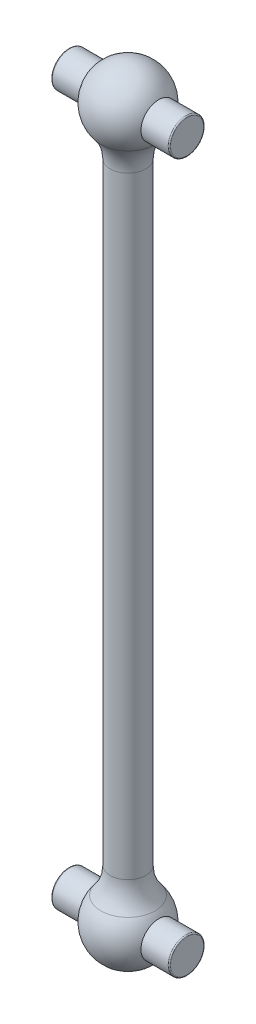
from build123d import *

# Parameters (mm, degrees)
SKETCH1_R           = 1.905
BOSS_EXTRUDE1_DEPTH = 38.1
SKETCH3_R           = 1.905
BOSS_EXTRUDE2_DEPTH = 6.35
FILLET1_R           = 0.127
MIRROR1_START       = -32.866055516
MIRROR1_2_OUTLINE_R = 1.905
MIRROR1_2_DEPTH     = 32.866055516


with BuildPart() as part:
    # Sketch1 → Boss-Extrude1 (new body)
    with BuildSketch(Plane(origin=(0, 0, 0), x_dir=(1, 0, 0), z_dir=(0, 1, 0))):
        with Locations(Location((0, 0, 0), (0, 0, 90))):
            Circle(SKETCH1_R)
    extrude(amount=BOSS_EXTRUDE1_DEPTH)

    # Sketch2 → Revolve2 (revolve)
    with BuildSketch(Plane.XY, mode=Mode.PRIVATE) as revolve2_sk:
        with BuildLine():
            Line((1.905, 32.866055516), (0, 32.866055516))
            Line((0, 32.866055516), (0, 41.91))
            ThreePointArc((0, 41.91), (3.453032669, 39.710175577), (2.918629328, 35.650979207))
            ThreePointArc((2.918629328, 35.650979207), (2.166286071, 34.347882461), (1.905, 32.866055516))
        make_face()
    revolve(revolve2_sk.sketch.rotate(Axis((0, 41.91, 0), (0, -1, 0)), 270), axis=Axis((0, 41.91, 0), (0, -1, 0)))

    # Sketch3 → Boss-Extrude2 (add, symmetric)
    with BuildSketch(Plane(origin=(0, 0, 0), x_dir=(0, 0, -1), z_dir=(1, 0, 0))):
        with Locations(Location((0, 38.1, 0), (0, 0, 180))):
            Circle(SKETCH3_R)
    extrude(amount=BOSS_EXTRUDE2_DEPTH, both=True)

    # Fillet1
    fillet1_edges = [part.edges().sort_by_distance(p)[0] for p in [
        (-6.35, 38.1, -1.905),
        (6.35, 38.1, -1.905),
    ]]
    fillet(fillet1_edges, radius=FILLET1_R)



with BuildPart() as body_2:
    # Mirror1: read off the stored shape, not the designer's step
    # Mirror1 outline → Mirror1 (revolve)
    with BuildSketch(Plane.XY):
        with BuildLine():
            Line((0, -32.866055516), (0, -41.91))
            ThreePointArc((0, -41.91), (3.453032669, -39.710175576), (2.918629327, -35.650979205))
            ThreePointArc((2.918629327, -35.650979205), (2.166286071, -34.347882461), (1.905, -32.866055516))
            Line((1.905, -32.866055516), (0, -32.866055516))
        make_face()
    revolve(axis=Axis((0, 0, 0), (0, 1, 0)))


with BuildPart() as part_1:
    add(part.part)

    add(body_2.part)  # Mirror1 2 merges body 2
    # Mirror1 2 outline → Mirror1 2 (add)
    with BuildSketch(Plane(origin=(0, 0, 0), x_dir=(1, 0, 0), z_dir=(0, 1, 0)).offset(MIRROR1_START)):
        Circle(MIRROR1_2_OUTLINE_R)
    extrude(amount=MIRROR1_2_DEPTH)

    # Mirror1 3 outline → Mirror1 3 (revolve)
    with BuildSketch(Plane(origin=(0, -38.1, 0), x_dir=(0, 1, 0), z_dir=(0, 0, -1))):
        with BuildLine():
            Line((1.778, 6.35), (0, 6.35))
            Line((0, 6.35), (0, 3.299556788))
            Line((0, 3.299556788), (1.905, 3.299556788))
            Line((1.905, 3.299556788), (1.905, 6.223))
            ThreePointArc((1.905, 6.223), (1.867802561, 6.312802561), (1.778, 6.35))
        make_face()
        with BuildLine():
            Line((1.905, -3.299556788), (0, -3.299556788))
            Line((0, -3.299556788), (0, -6.35))
            Line((0, -6.35), (1.778, -6.35))
            ThreePointArc((1.778, -6.35), (1.867802561, -6.312802561), (1.905, -6.223))
            Line((1.905, -6.223), (1.905, -3.299556788))
        make_face()
    revolve(axis=Axis((0, -38.1, 0), (1, 0, 0)))


solid = part_1.part
